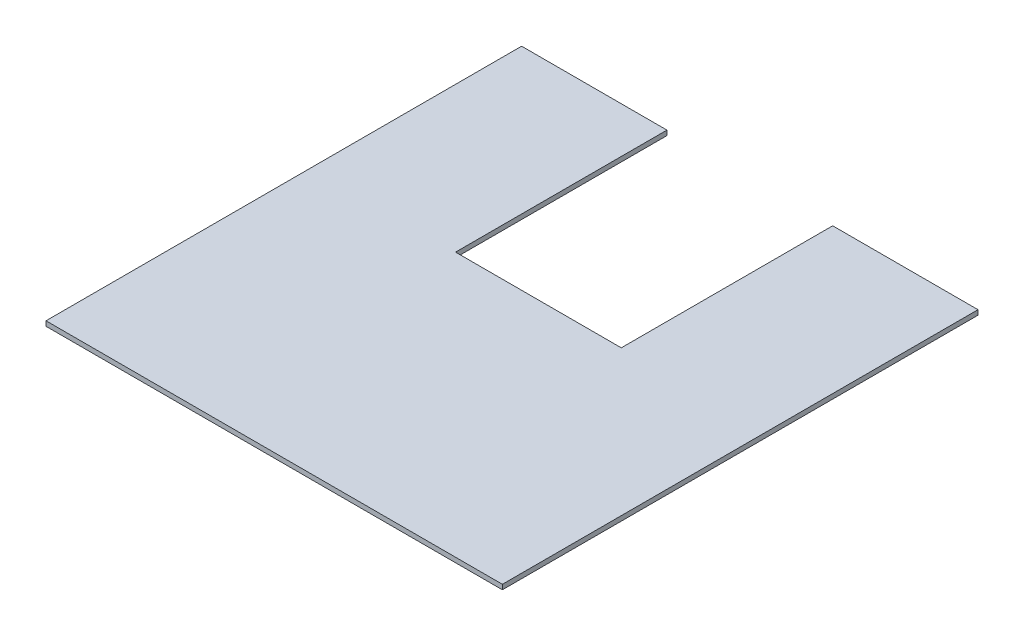
from build123d import *

# Parameters (mm, degrees)
SKETCH1_W           = 190
SKETCH1_H           = 198
BOSS_EXTRUDE1_DEPTH = 1
SKETCH2_W           = 69
SKETCH2_H           = 88
CUT_EXTRUDE1_DEPTH  = 138.222447143


with BuildPart() as part:
    # Sketch1 → Boss-Extrude1 (new, symmetric)
    with BuildSketch(Plane(origin=(0, 0, 0), x_dir=(1, 0, 0), z_dir=(0, 1, 0))):
        Rectangle(SKETCH1_W, SKETCH1_H)
    extrude(amount=BOSS_EXTRUDE1_DEPTH, both=True)

    # Sketch2 → Cut-Extrude1 (cut, through all)
    with BuildSketch(Plane(origin=(0, 1, 0), x_dir=(1, 0, 0), z_dir=(0, 1, 0))):
        with Locations((0, 55)):
            Rectangle(SKETCH2_W, SKETCH2_H)
    extrude(amount=-CUT_EXTRUDE1_DEPTH, mode=Mode.SUBTRACT)


solid = part.part
